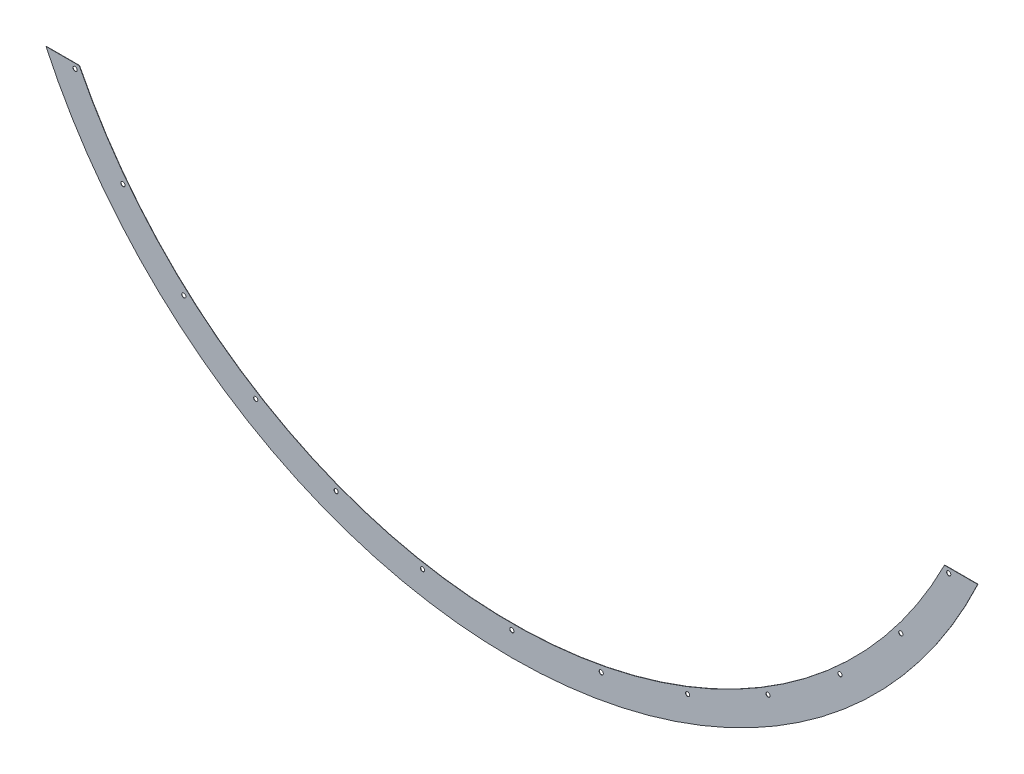
from build123d import *

# Parameters (mm, degrees)
BASE_FLANGE1_DEPTH              = 0.5
SKETCH2_W                       = 1968.518691842
SKETCH2_H                       = 782.123286761
CUT_EXTRUDE1_DEPTH              = 10
CUT_EXTRUDE3_DEPTH              = 10
SKETCH10_R                      = 3.5
CUT_EXTRUDE4_DEPTH              = 10
CIRPATTERN1_COUNT               = 10
CIRPATTERN1_ANGLE               = 94.5
CIRPATTERN1_THE_OTHER_WAY_COUNT = 10
CIRPATTERN1_THE_OTHER_WAY_ANGLE = 94.5


# Sheet-metal steps are written as plain solids
with BuildPart() as part:
    # Sketch1 → Base-Flange1 (new body)
    with BuildSketch(Plane.XY):
        with BuildLine():
            Line((859.985464993, -5), (-859.985464993, -5))
            ThreePointArc((-859.985464993, -5), (0, -860), (859.985464993, -5))
        make_face()
    extrude(amount=-BASE_FLANGE1_DEPTH)

    # Sketch2 → Cut-Extrude1 (cut)
    with BuildSketch(Plane.XY):
        with Locations((10.387961435, 27.061643381)):
            Rectangle(SKETCH2_W, SKETCH2_H)
    extrude(amount=-CUT_EXTRUDE1_DEPTH, mode=Mode.SUBTRACT)

    # Sketch9 → Cut-Extrude3 (cut)
    with BuildSketch(Plane.XY):
        with BuildLine():
            Line((-723.60486455, -364), (723.60486455, -364))
            ThreePointArc((723.60486455, -364), (0, -810), (-723.60486455, -364))
        make_face()
    extrude(amount=-CUT_EXTRUDE3_DEPTH, mode=Mode.SUBTRACT)

    # Sketch10 → Cut-Extrude4 (cut)
    with BuildSketch(Plane(origin=(0, 0, -0.5), x_dir=(-1, 0, 0), z_dir=(0, 0, -1))):
        with Locations((0, -820)):
            Circle(SKETCH10_R)
    cut_extrude4 = extrude(amount=-CUT_EXTRUDE4_DEPTH, mode=Mode.SUBTRACT)

    # CirPattern1: Cut-Extrude4 ×10 about axis
    cirpattern1_axis = Axis((0, 0, 0), (0, 0, 1))
    for i in range(1, CIRPATTERN1_COUNT):
        add(cut_extrude4.rotate(cirpattern1_axis, i * CIRPATTERN1_ANGLE / (CIRPATTERN1_COUNT - 1)), mode=Mode.SUBTRACT)

    # CirPattern1 the other way: Cut-Extrude4 ×10 about axis
    cirpattern1_the_other_way_axis = Axis((0, 0, 0), (0, 0, -1))
    for i in range(1, CIRPATTERN1_THE_OTHER_WAY_COUNT):
        add(cut_extrude4.rotate(cirpattern1_the_other_way_axis, i * CIRPATTERN1_THE_OTHER_WAY_ANGLE / (CIRPATTERN1_THE_OTHER_WAY_COUNT - 1)), mode=Mode.SUBTRACT)


solid = part.part
